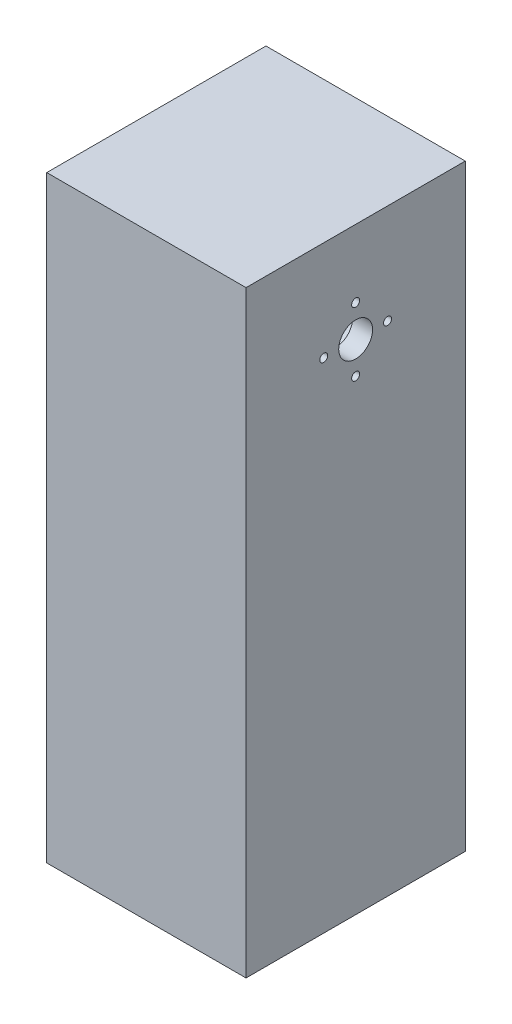
from build123d import *

# Parameters (mm, degrees)
SKETCH1_W               = 50
SKETCH1_H               = 150
BOSS_EXTRUDE1_DEPTH     = 55
CUT_EXTRUDE1_DEPTH      = 168.406690428
CUT_EXTRUDE1_DEPTH_BACK = 45
SKETCH2_R               = 10.25
SKETCH7_R               = 1
SKETCH7_R_2             = 4.25
CUT_EXTRUDE3_DEPTH      = 10
BOSS_EXTRUDE2_START     = 45
SKETCH8_R               = 10.25
SKETCH8_R_2             = 1
SKETCH8_R_3             = 4.25
BOSS_EXTRUDE2_DEPTH     = 45
SKETCH9_R               = 10.25
CUT_EXTRUDE4_DEPTH      = 45


with BuildPart() as part:
    # Sketch1 → Boss-Extrude1 (new body)
    with BuildSketch(Plane.XY):
        with Locations((0, -75)):
            Rectangle(SKETCH1_W, SKETCH1_H)
    extrude(amount=-BOSS_EXTRUDE1_DEPTH)

    # Sketch2 → Cut-Extrude1 (cut, two sides: drawn at the far end of the back side and taken through both)
    with BuildSketch(Plane(origin=(25, 0, 0), x_dir=(0, 0, -1), z_dir=(1, 0, 0)).offset(-CUT_EXTRUDE1_DEPTH_BACK)):
        with Locations((27.5, -25)):
            Circle(SKETCH2_R)
    extrude(amount=CUT_EXTRUDE1_DEPTH + CUT_EXTRUDE1_DEPTH_BACK, mode=Mode.SUBTRACT)

    # Sketch7 → Cut-Extrude3 (cut)
    with BuildSketch(Plane(origin=(-20, 0, 0), x_dir=(0, 0, -1), z_dir=(1, 0, 0))):
        with Locations((27.5, -17)):
            Circle(SKETCH7_R)
        with Locations((27.5, -25)):
            Circle(SKETCH7_R_2)
        with Locations((35.5, -25)):
            Circle(SKETCH7_R)
        with Locations((19.5, -25)):
            Circle(SKETCH7_R)
        with Locations((27.5, -33)):
            Circle(SKETCH7_R)
    extrude(amount=-CUT_EXTRUDE3_DEPTH, mode=Mode.SUBTRACT)

    # Sketch8 → Boss-Extrude2 (add)
    with BuildSketch(Plane(origin=(-20, 0, 0), x_dir=(0, 0, -1), z_dir=(1, 0, 0)).offset(BOSS_EXTRUDE2_START)):
        with Locations((27.5, -25)):
            Circle(SKETCH8_R)
        with Locations((27.5, -17)):
            Circle(SKETCH8_R_2, mode=Mode.SUBTRACT)
        with Locations((27.5, -25)):
            Circle(SKETCH8_R_3, mode=Mode.SUBTRACT)
        with Locations((35.5, -25)):
            Circle(SKETCH8_R_2, mode=Mode.SUBTRACT)
        with Locations((27.5, -33)):
            Circle(SKETCH8_R_2, mode=Mode.SUBTRACT)
        with Locations((19.5, -25)):
            Circle(SKETCH8_R_2, mode=Mode.SUBTRACT)
    extrude(amount=-BOSS_EXTRUDE2_DEPTH)

    # Sketch9 → Cut-Extrude4 (cut)
    with BuildSketch(Plane.ZY.offset(25)):
        with Locations((-27.5, -25)):
            Circle(SKETCH9_R)
    extrude(amount=-CUT_EXTRUDE4_DEPTH, mode=Mode.SUBTRACT)


solid = part.part
